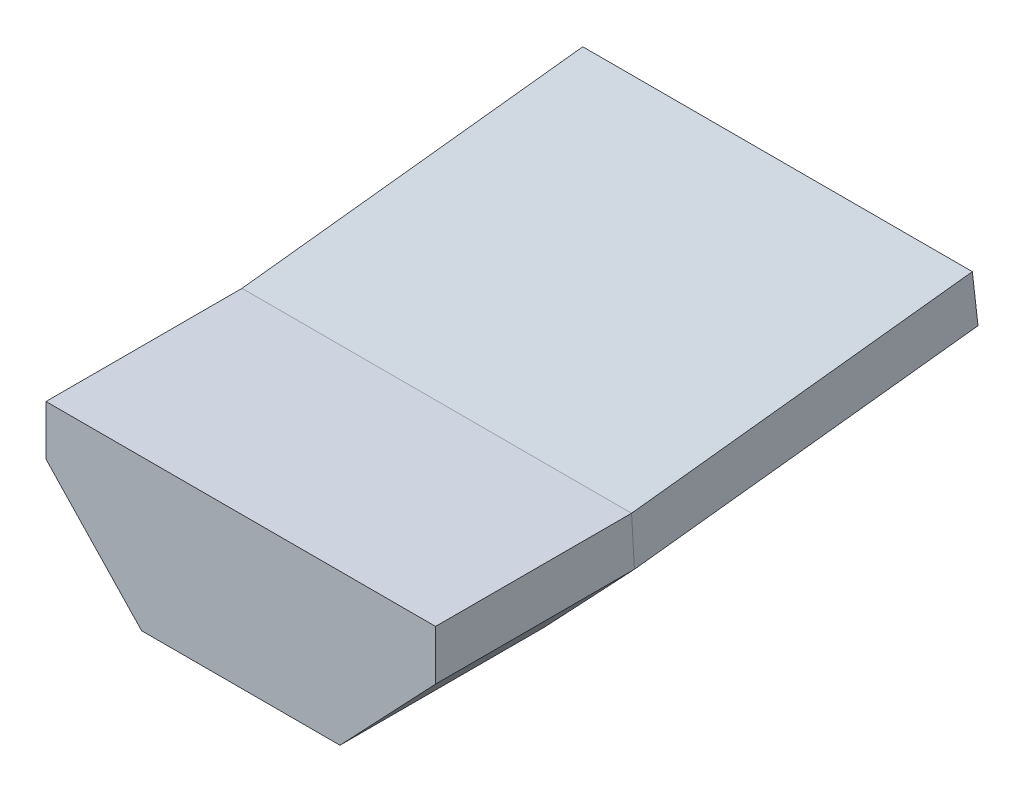
from build123d import *


with BuildPart() as part:
    # Sweep1: sweep along a path in Sketch2
    with BuildLine(Plane(origin=(0, 0, 0), x_dir=(0, 0, -1), z_dir=(1, 0, 0))) as sweep1_path:
        Line((0, 0), (8, 0))
        Line((8, 0), (21.910005979, 1.584844993))
    # Sketch1 → Sweep1 (sweep)
    with BuildSketch(Plane.XY):
        Polygon((7.95, 0), (7.95, -2.04), (4.048, -6.152414984), (-4.048, -6.152414984), (-7.95, -2.04), (-7.95, 0), align=None)
    sweep(path=sweep1_path.line, transition=Transition.RIGHT)


solid = part.part
